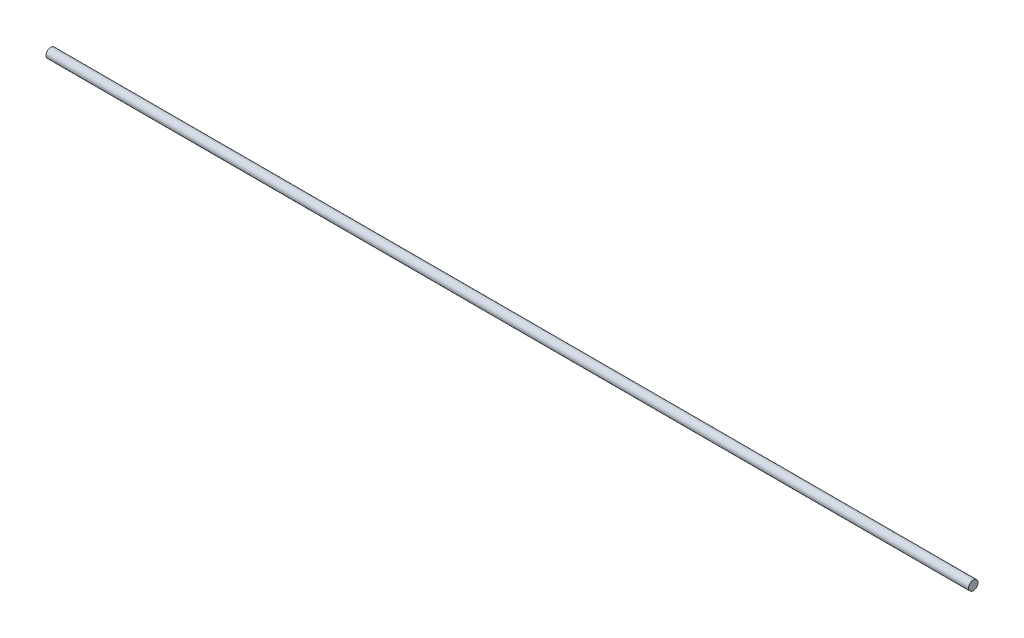
from build123d import *

# Parameters (mm, degrees)
SKETCH1_R           = 3.2
BOSS_EXTRUDE1_DEPTH = 628


with BuildPart() as part:
    # Sketch1 → Boss-Extrude1 (new body)
    with BuildSketch(Plane(origin=(0, 0, 0), x_dir=(0, 0, -1), z_dir=(1, 0, 0))):
        Circle(SKETCH1_R)
    extrude(amount=BOSS_EXTRUDE1_DEPTH)


solid = part.part
